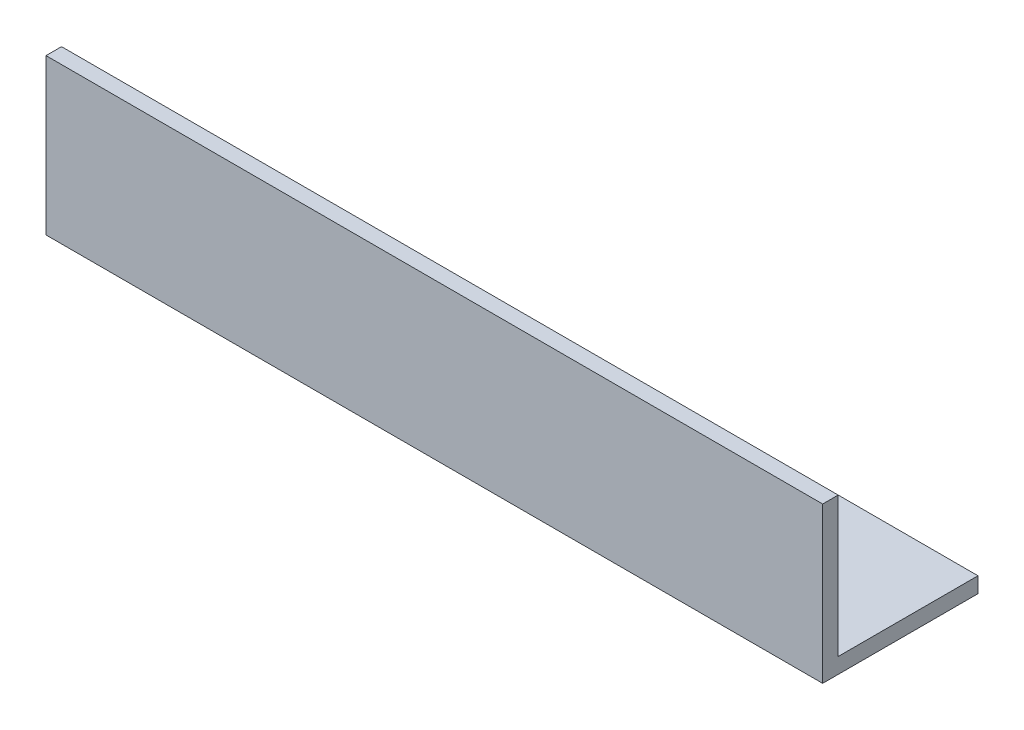
from build123d import *

# Parameters (mm, degrees)
EXTRUDE_1_DEPTH     = 150
SKETCH_2_R          = 5
CUT_EXTRUDE_1_DEPTH = 156.884572681


with BuildPart() as part:
    # Эскиз1 → Вытянуть-Тонкостенный1 (new body)
    with BuildSketch(Plane(origin=(0, 0, 0), x_dir=(0, 0, -1), z_dir=(1, 0, 0))):
        Polygon((30, 0), (0, 0), (0, 30), (3, 30), (3, 3), (30, 3), align=None)
    extrude(amount=EXTRUDE_1_DEPTH)

    # Эскиз2 → Вырез-Вытянуть1 (cut, through all)
    with BuildSketch(Plane.XZ):
        with Locations((130, -15)):
            Circle(SKETCH_2_R)
        with Locations((100, -15)):
            Circle(SKETCH_2_R)
        with Locations((50, -15)):
            Circle(SKETCH_2_R)
        with Locations((20, -15)):
            Circle(SKETCH_2_R)
    extrude(amount=-CUT_EXTRUDE_1_DEPTH, mode=Mode.SUBTRACT)


solid = part.part
